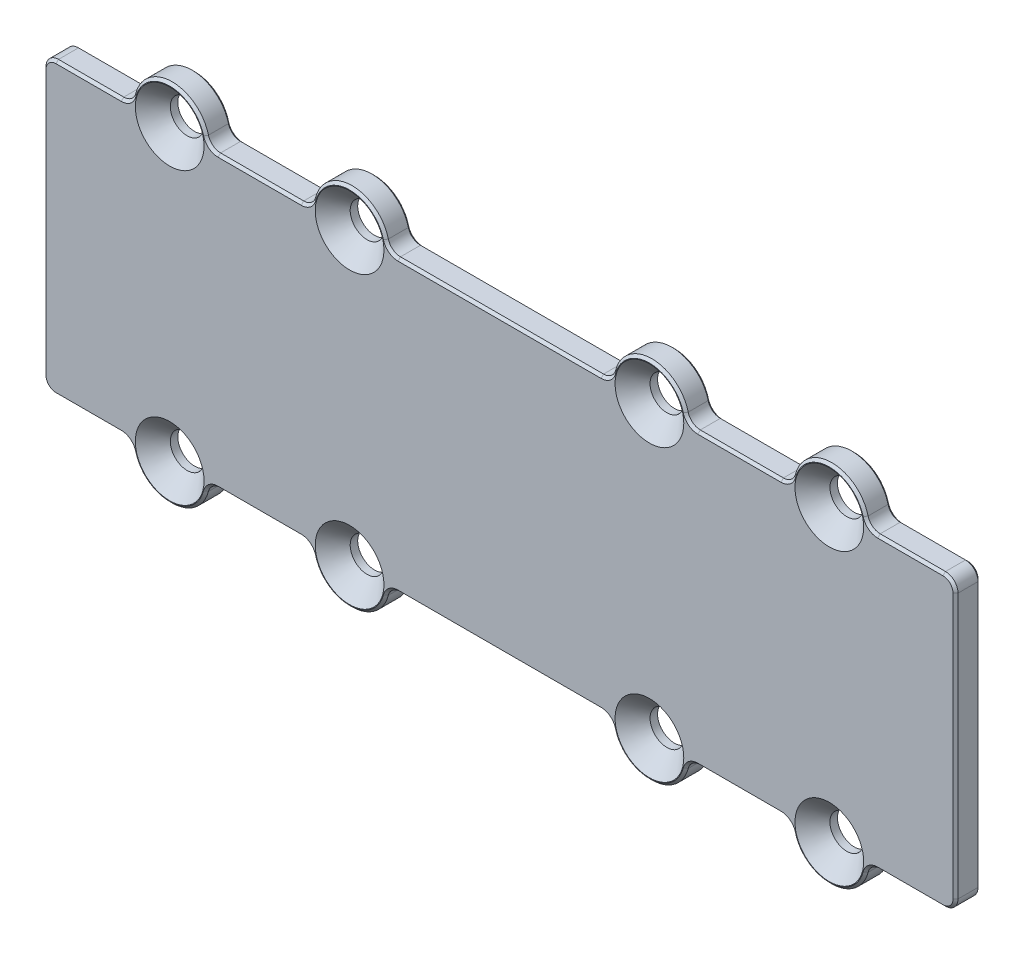
from build123d import *

# Parameters (mm, degrees)
EXTRUDE_1_DEPTH                = 2
FILLET_1_R                     = 1
HOLE_WIZARD_M2_5_1_D           = 2.7
HOLE_WIZARD_M2_5_1_DEPTH       = 5.538838164
HOLE_WIZARD_M2_5_1_CSINK_D     = 5.5
HOLE_WIZARD_M2_5_1_CSINK_ANGLE = 90
HOLE_WIZARD_M2_5_1_TIP         = 0.811161836
CHAMFER_1_SIZE                 = 0.2


with BuildPart() as part:
    # 草图1 → 凸台-拉伸1 (new body)
    with BuildSketch(Plane.XY):
        with BuildLine():
            ThreePointArc((-23.4, 11.6), (-26.4, 14.6), (-29.4, 11.6))
            Line((-29.4, 11.6), (-36.5, 11.6))
            Line((-36.5, 11.6), (-36.5, -11.6))
            Line((-36.5, -11.6), (-29.4, -11.6))
            ThreePointArc((-29.4, -11.6), (-26.4, -14.6), (-23.4, -11.6))
            Line((-23.4, -11.6), (-15, -11.6))
            ThreePointArc((-15, -11.6), (-12, -14.6), (-9, -11.6))
            Line((-9, -11.6), (9, -11.6))
            ThreePointArc((9, -11.6), (12, -14.6), (15, -11.6))
            Line((15, -11.6), (23.4, -11.6))
            ThreePointArc((23.4, -11.6), (26.4, -14.6), (29.4, -11.6))
            Line((29.4, -11.6), (36.5, -11.6))
            Line((36.5, -11.6), (36.5, 11.6))
            Line((36.5, 11.6), (29.4, 11.6))
            ThreePointArc((29.4, 11.6), (26.4, 14.6), (23.4, 11.6))
            Line((23.4, 11.6), (15, 11.6))
            ThreePointArc((15, 11.6), (12, 14.6), (9, 11.6))
            Line((9, 11.6), (-9, 11.6))
            ThreePointArc((-9, 11.6), (-12, 14.6), (-15, 11.6))
            Line((-15, 11.6), (-23.4, 11.6))
        make_face()
    extrude(amount=EXTRUDE_1_DEPTH)

    # 圆角1
    fillet_1_edges = [part.edges().sort_by_distance(p)[0] for p in [
        (15, 11.6, 1),
        (23.4, 11.6, 1),
        (29.4, 11.6, 1),
        (36.5, 11.6, 1),
        (29.4, -11.6, 1),
        (23.4, -11.6, 1),
        (15, -11.6, 1),
        (9, -11.6, 1),
        (-9, -11.6, 1),
        (-15, -11.6, 1),
        (-23.4, -11.6, 1),
        (-29.4, -11.6, 1),
        (-36.5, -11.6, 1),
        (-36.5, 11.6, 1),
        (-29.4, 11.6, 1),
        (-23.4, 11.6, 1),
        (-15, 11.6, 1),
        (-9, 11.6, 1),
        (9, 11.6, 1),
        (36.5, -11.6, 1),
    ]]
    fillet(fillet_1_edges, radius=FILLET_1_R)

    # M2.5 锥坑平头螺钉的锥形沉头孔1
    with Locations(Plane(origin=(-26.4, 11.6, 2), x_dir=(1, 0, 0), z_dir=(0, 0, 1))):
        with Locations((0, 0), (14.4, 0), (38.4, 0), (52.8, 0), (52.8, -23.2), (38.4, -23.2), (14.4, -23.2), (0, -23.2)):
            CounterSinkHole(HOLE_WIZARD_M2_5_1_D / 2, HOLE_WIZARD_M2_5_1_CSINK_D / 2, depth=HOLE_WIZARD_M2_5_1_DEPTH, counter_sink_angle=HOLE_WIZARD_M2_5_1_CSINK_ANGLE)
            with Locations((0, 0, -(HOLE_WIZARD_M2_5_1_DEPTH + HOLE_WIZARD_M2_5_1_TIP / 2))):  # 118° drill point
                Cone(0, HOLE_WIZARD_M2_5_1_D / 2, HOLE_WIZARD_M2_5_1_TIP, mode=Mode.SUBTRACT)

    # 倒角1
    chamfer_1_edges = [part.edges().sort_by_distance(p)[0] for p in [
        (36.5, 0, 2),
        (36.207106781, 11.307106781, 2),
        (36.207106781, -11.307106781, 2),
        (32.886491673, 11.6, 2),
        (32.886491673, -11.6, 2),
        (29.660610911, 11.809430585, 2),
        (29.660610911, -11.809430585, 2),
        (26.4, 14.6, 2),
        (26.4, -14.6, 2),
        (23.139389089, 11.809430585, 2),
        (23.139389089, -11.809430585, 2),
        (19.2, 11.6, 2),
        (19.2, -11.6, 2),
        (15.260610911, 11.809430585, 2),
        (15.260610911, -11.809430585, 2),
        (12, 14.6, 2),
        (12, -14.6, 2),
        (8.739389089, 11.809430585, 2),
        (8.739389089, -11.809430585, 2),
        (0, 11.6, 2),
        (0, -11.6, 2),
        (-8.739389089, 11.809430585, 2),
        (-8.739389089, -11.809430585, 2),
        (-12, 14.6, 2),
        (-12, -14.6, 2),
        (-15.260610911, 11.809430585, 2),
        (-15.260610911, -11.809430585, 2),
        (-19.2, 11.6, 2),
        (-19.2, -11.6, 2),
        (-23.139389089, 11.809430585, 2),
        (-23.139389089, -11.809430585, 2),
        (-26.4, 14.6, 2),
        (-26.4, -14.6, 2),
        (-29.660610911, 11.809430585, 2),
        (-29.660610911, -11.809430585, 2),
        (-32.886491673, 11.6, 2),
        (-32.886491673, -11.6, 2),
        (-36.207106781, 11.307106781, 2),
        (-36.207106781, -11.307106781, 2),
        (-36.5, 0, 2),
        (36.5, 0, 0),
        (36.207106781, 11.307106781, 0),
        (36.207106781, -11.307106781, 0),
        (32.886491673, 11.6, 0),
        (32.886491673, -11.6, 0),
        (29.660610911, 11.809430585, 0),
        (29.660610911, -11.809430585, 0),
        (26.4, 14.6, 0),
        (26.4, -14.6, 0),
        (23.139389089, 11.809430585, 0),
        (23.139389089, -11.809430585, 0),
        (19.2, 11.6, 0),
        (19.2, -11.6, 0),
        (15.260610911, 11.809430585, 0),
        (15.260610911, -11.809430585, 0),
        (12, 14.6, 0),
        (12, -14.6, 0),
        (8.739389089, 11.809430585, 0),
        (8.739389089, -11.809430585, 0),
        (0, 11.6, 0),
        (0, -11.6, 0),
        (-8.739389089, 11.809430585, 0),
        (-8.739389089, -11.809430585, 0),
        (-12, 14.6, 0),
        (-12, -14.6, 0),
        (-15.260610911, 11.809430585, 0),
        (-15.260610911, -11.809430585, 0),
        (-19.2, 11.6, 0),
        (-19.2, -11.6, 0),
        (-23.139389089, 11.809430585, 0),
        (-23.139389089, -11.809430585, 0),
        (-26.4, 14.6, 0),
        (-26.4, -14.6, 0),
        (-29.660610911, 11.809430585, 0),
        (-29.660610911, -11.809430585, 0),
        (-32.886491673, 11.6, 0),
        (-32.886491673, -11.6, 0),
        (-36.207106781, 11.307106781, 0),
        (-36.207106781, -11.307106781, 0),
        (-36.5, 0, 0),
    ]]
    chamfer(chamfer_1_edges, length=CHAMFER_1_SIZE)


solid = part.part
